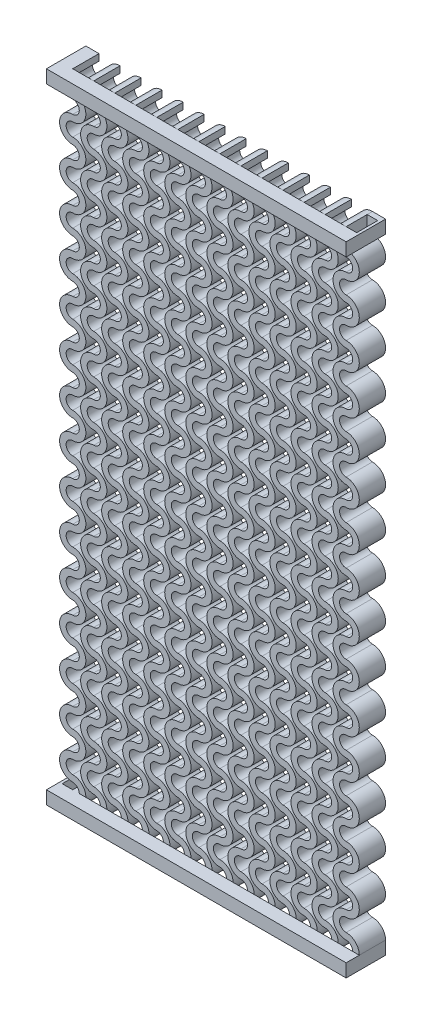
from build123d import *

# Parameters (mm, degrees)
BOSS_EXTRUDE1_DEPTH = 6.35
LPATTERN1_COUNT     = 14
LPATTERN1_PITCH     = 5.08
SKETCH5_W           = 3.175
SKETCH5_H           = 3.175
BOSS_EXTRUDE2_DEPTH = 69.215
SKETCH6_W           = 3.175
SKETCH6_H           = 3.175
BOSS_EXTRUDE3_DEPTH = 69.215
BOSS_EXTRUDE5_DEPTH = 6.35
BOSS_EXTRUDE6_DEPTH = 3.175
BOSS_EXTRUDE7_DEPTH = 3.175
CUT_EXTRUDE1_REACH  = 171.096
SKETCH11_W          = 2.54
SKETCH11_H          = 5.08
CUT_EXTRUDE2_REACH  = 171.096
SKETCH12_W          = 2.54
SKETCH12_H          = 5.08


with BuildPart() as part:
    # Sketch2 → Boss-Extrude1 (new body)
    with BuildSketch(Plane.XY):
        with BuildLine():
            Line((0, -3.175), (0, -1.5875))
            ThreePointArc((0, -1.5875), (1.5875, 0), (0, 1.5875))
            ThreePointArc((0, 1.5875), (-3.175, 4.7625), (0, 7.9375))
            ThreePointArc((0, 7.9375), (1.5875, 9.525), (0, 11.1125))
            ThreePointArc((0, 11.1125), (-3.175, 14.2875), (0, 17.4625))
            ThreePointArc((0, 17.4625), (1.5875, 19.05), (0, 20.6375))
            ThreePointArc((0, 20.6375), (-3.175, 23.8125), (0, 26.9875))
            ThreePointArc((0, 26.9875), (1.5875, 28.575), (0, 30.1625))
            ThreePointArc((0, 30.1625), (-3.175, 33.3375), (0, 36.5125))
            ThreePointArc((0, 36.5125), (1.5875, 38.1), (0, 39.6875))
            ThreePointArc((0, 39.6875), (-3.175, 42.8625), (0, 46.0375))
            ThreePointArc((0, 46.0375), (1.5875, 47.625), (0, 49.2125))
            ThreePointArc((0, 49.2125), (-3.175, 52.3875), (0, 55.5625))
            ThreePointArc((0, 55.5625), (1.5875, 57.15), (0, 58.7375))
            ThreePointArc((0, 58.7375), (-3.175, 61.9125), (0, 65.0875))
            ThreePointArc((0, 65.0875), (1.5875, 66.675), (0, 68.2625))
            ThreePointArc((0, 68.2625), (-3.175, 71.4375), (0, 74.6125))
            ThreePointArc((0, 74.6125), (1.5875, 76.2), (0, 77.7875))
            ThreePointArc((0, 77.7875), (-3.175, 80.9625), (0, 84.1375))
            ThreePointArc((0, 84.1375), (1.5875, 85.725), (0, 87.3125))
            ThreePointArc((0, 87.3125), (-3.175, 90.4875), (0, 93.6625))
            ThreePointArc((0, 93.6625), (1.5875, 95.25), (0, 96.8375))
            ThreePointArc((0, 96.8375), (-3.175, 100.0125), (0, 103.1875))
            ThreePointArc((0, 103.1875), (1.5875, 104.775), (0, 106.3625))
            ThreePointArc((0, 106.3625), (-3.175, 109.5375), (0, 112.7125))
            ThreePointArc((0, 112.7125), (1.5875, 114.3), (0, 115.8875))
            ThreePointArc((0, 115.8875), (-3.175, 119.0625), (0, 122.2375))
            ThreePointArc((0, 122.2375), (1.5875, 123.825), (0, 125.4125))
            ThreePointArc((0, 125.4125), (-3.175, 128.5875), (0, 131.7625))
            ThreePointArc((0, 131.7625), (1.5875, 133.35), (0, 134.9375))
            ThreePointArc((0, 134.9375), (-3.175, 138.1125), (0, 141.2875))
            ThreePointArc((0, 141.2875), (1.5875, 142.875), (0, 144.4625))
            ThreePointArc((0, 144.4625), (-3.175, 147.6375), (0, 150.8125))
            Line((0, 150.8125), (0, 149.225))
            ThreePointArc((0, 149.225), (-1.5875, 147.6375), (0, 146.05))
            ThreePointArc((0, 146.05), (3.175, 142.875), (0, 139.7))
            ThreePointArc((0, 139.7), (-1.5875, 138.1125), (0, 136.525))
            ThreePointArc((0, 136.525), (3.175, 133.35), (0, 130.175))
            ThreePointArc((0, 130.175), (-1.5875, 128.5875), (0, 127))
            ThreePointArc((0, 127), (3.175, 123.825), (0, 120.65))
            ThreePointArc((0, 120.65), (-1.5875, 119.0625), (0, 117.475))
            ThreePointArc((0, 117.475), (3.175, 114.3), (0, 111.125))
            ThreePointArc((0, 111.125), (-1.5875, 109.5375), (0, 107.95))
            ThreePointArc((0, 107.95), (3.175, 104.775), (0, 101.6))
            ThreePointArc((0, 101.6), (-1.5875, 100.0125), (0, 98.425))
            ThreePointArc((0, 98.425), (3.175, 95.25), (0, 92.075))
            ThreePointArc((0, 92.075), (-1.5875, 90.4875), (0, 88.9))
            ThreePointArc((0, 88.9), (3.175, 85.725), (0, 82.55))
            ThreePointArc((0, 82.55), (-1.5875, 80.9625), (0, 79.375))
            ThreePointArc((0, 79.375), (3.175, 76.2), (0, 73.025))
            ThreePointArc((0, 73.025), (-1.5875, 71.4375), (0, 69.85))
            ThreePointArc((0, 69.85), (3.175, 66.675), (0, 63.5))
            ThreePointArc((0, 63.5), (-1.5875, 61.9125), (0, 60.325))
            ThreePointArc((0, 60.325), (3.175, 57.15), (0, 53.975))
            ThreePointArc((0, 53.975), (-1.5875, 52.3875), (0, 50.8))
            ThreePointArc((0, 50.8), (3.175, 47.625), (0, 44.45))
            ThreePointArc((0, 44.45), (-1.5875, 42.8625), (0, 41.275))
            ThreePointArc((0, 41.275), (3.175, 38.1), (0, 34.925))
            ThreePointArc((0, 34.925), (-1.5875, 33.3375), (0, 31.75))
            ThreePointArc((0, 31.75), (3.175, 28.575), (0, 25.4))
            ThreePointArc((0, 25.4), (-1.5875, 23.8125), (0, 22.225))
            ThreePointArc((0, 22.225), (3.175, 19.05), (0, 15.875))
            ThreePointArc((0, 15.875), (-1.5875, 14.2875), (0, 12.7))
            ThreePointArc((0, 12.7), (3.175, 9.525), (0, 6.35))
            ThreePointArc((0, 6.35), (-1.5875, 4.7625), (0, 3.175))
            ThreePointArc((0, 3.175), (3.175, 0), (0, -3.175))
        make_face()
    extrude(amount=BOSS_EXTRUDE1_DEPTH)


with BuildPart() as lpattern1_1:
    # LPattern1: pattern copy
    add(part.part.moved(Location(Vector(1, 0, 0) * (1 * LPATTERN1_PITCH))))


with BuildPart() as lpattern1_2:
    # LPattern1: pattern copy
    add(part.part.moved(Location(Vector(1, 0, 0) * (2 * LPATTERN1_PITCH))))


with BuildPart() as lpattern1_3:
    # LPattern1: pattern copy
    add(part.part.moved(Location(Vector(1, 0, 0) * (3 * LPATTERN1_PITCH))))


with BuildPart() as lpattern1_4:
    # LPattern1: pattern copy
    add(part.part.moved(Location(Vector(1, 0, 0) * (4 * LPATTERN1_PITCH))))


with BuildPart() as lpattern1_5:
    # LPattern1: pattern copy
    add(part.part.moved(Location(Vector(1, 0, 0) * (5 * LPATTERN1_PITCH))))


with BuildPart() as lpattern1_6:
    # LPattern1: pattern copy
    add(part.part.moved(Location(Vector(1, 0, 0) * (6 * LPATTERN1_PITCH))))


with BuildPart() as lpattern1_7:
    # LPattern1: pattern copy
    add(part.part.moved(Location(Vector(1, 0, 0) * (7 * LPATTERN1_PITCH))))


with BuildPart() as lpattern1_8:
    # LPattern1: pattern copy
    add(part.part.moved(Location(Vector(1, 0, 0) * (8 * LPATTERN1_PITCH))))


with BuildPart() as lpattern1_9:
    # LPattern1: pattern copy
    add(part.part.moved(Location(Vector(1, 0, 0) * (9 * LPATTERN1_PITCH))))


with BuildPart() as lpattern1_10:
    # LPattern1: pattern copy
    add(part.part.moved(Location(Vector(1, 0, 0) * (10 * LPATTERN1_PITCH))))


with BuildPart() as lpattern1_11:
    # LPattern1: pattern copy
    add(part.part.moved(Location(Vector(1, 0, 0) * (11 * LPATTERN1_PITCH))))


with BuildPart() as lpattern1_12:
    # LPattern1: pattern copy
    add(part.part.moved(Location(Vector(1, 0, 0) * (12 * LPATTERN1_PITCH))))


with BuildPart() as lpattern1_13:
    # LPattern1: pattern copy
    add(part.part.moved(Location(Vector(1, 0, 0) * (13 * LPATTERN1_PITCH))))


with BuildPart() as part_1:
    add(part.part)

    add(lpattern1_1.part)  # Boss-Extrude2 merges LPattern1_1

    add(lpattern1_2.part)  # Boss-Extrude2 merges LPattern1_2

    add(lpattern1_3.part)  # Boss-Extrude2 merges LPattern1_3

    add(lpattern1_4.part)  # Boss-Extrude2 merges LPattern1_4

    add(lpattern1_5.part)  # Boss-Extrude2 merges LPattern1_5

    add(lpattern1_6.part)  # Boss-Extrude2 merges LPattern1_6

    add(lpattern1_7.part)  # Boss-Extrude2 merges LPattern1_7

    add(lpattern1_8.part)  # Boss-Extrude2 merges LPattern1_8

    add(lpattern1_9.part)  # Boss-Extrude2 merges LPattern1_9

    add(lpattern1_10.part)  # Boss-Extrude2 merges LPattern1_10

    add(lpattern1_11.part)  # Boss-Extrude2 merges LPattern1_11

    add(lpattern1_12.part)  # Boss-Extrude2 merges LPattern1_12

    add(lpattern1_13.part)  # Boss-Extrude2 merges LPattern1_13
    # Sketch5 → Boss-Extrude2 (add, through all)
    with BuildSketch(Plane(origin=(66.04, 0, 0), x_dir=(0, 0, -1), z_dir=(1, 0, 0))):
        with Locations((-7.9375, 149.225)):
            Rectangle(SKETCH5_W, SKETCH5_H)
    extrude(amount=-BOSS_EXTRUDE2_DEPTH)

    # Sketch6 → Boss-Extrude3 (add, through all)
    with BuildSketch(Plane.ZY):
        with Locations((7.9375, -1.5875)):
            Rectangle(SKETCH6_W, SKETCH6_H)
    extrude(amount=-BOSS_EXTRUDE3_DEPTH)

    # Sketch8 → Boss-Extrude5 (add, through all)
    with BuildSketch(Plane(origin=(0, 0, 6.35), x_dir=(-1, 0, 0), z_dir=(0, 0, -1))):
        with BuildLine():
            Line((-66.04, 147.6375), (-64.4525, 147.6375))
            ThreePointArc((-64.4525, 147.6375), (-64.917467985, 148.760032015), (-66.04, 149.225))
            Line((-66.04, 149.225), (-66.04, 147.6375))
        make_face()
        with BuildLine():
            Line((3.175, 147.6375), (3.175, 150.8125))
            Line((3.175, 150.8125), (0, 150.8125))
            ThreePointArc((0, 150.8125), (2.24506403, 149.88256403), (3.175, 147.6375))
        make_face()
        with BuildLine():
            Line((0, -1.5875), (0, 0))
            Line((0, 0), (-1.5875, 0))
            ThreePointArc((-1.5875, 0), (-1.122532015, -1.122532015), (0, -1.5875))
        make_face()
        with BuildLine():
            Line((-69.215, 0), (-69.215, -3.175))
            Line((-69.215, -3.175), (-66.04, -3.175))
            ThreePointArc((-66.04, -3.175), (-68.28506403, -2.24506403), (-69.215, 0))
        make_face()
    extrude(amount=BOSS_EXTRUDE5_DEPTH)

    # Sketch9 → Boss-Extrude6 (add, through all)
    with BuildSketch(Plane.ZY):
        Polygon((9.525, 0), (0, 0), (0, -3.175), (6.35, -3.175), (9.525, -3.175), align=None)
    extrude(amount=BOSS_EXTRUDE6_DEPTH)

    # Sketch10 → Boss-Extrude7 (add, through all)
    with BuildSketch(Plane(origin=(66.04, 0, 0), x_dir=(0, 0, -1), z_dir=(1, 0, 0))):
        Polygon((-9.525, 147.6375), (0, 147.6375), (0, 150.8125), (-6.35, 150.8125), (-9.525, 150.8125), align=None)
    extrude(amount=BOSS_EXTRUDE7_DEPTH)

    # Sketch11 → Cut-Extrude1 (cut, up to next)
    with BuildSketch(Plane(origin=(0, 150.8125, 0), x_dir=(1, 0, 0), z_dir=(0, 1, 0)), mode=Mode.PRIVATE) as cut_extrude1_sk1:
        with Locations((67.31, -3.81)):
            Rectangle(SKETCH11_W, SKETCH11_H)
    cut_extrude1_tool1 = extrude(cut_extrude1_sk1.sketch, amount=-CUT_EXTRUDE1_REACH, mode=Mode.PRIVATE) & part_1.part
    add(cut_extrude1_tool1.solids().sort_by_distance((67.31, 150.8125, 3.81))[0], mode=Mode.SUBTRACT)

    # Sketch12 → Cut-Extrude2 (cut, up to next)
    with BuildSketch(Plane.XZ.offset(3.175), mode=Mode.PRIVATE) as cut_extrude2_sk1:
        with Locations((-1.27, 3.81)):
            Rectangle(SKETCH12_W, SKETCH12_H)
    cut_extrude2_tool1 = extrude(cut_extrude2_sk1.sketch, amount=-CUT_EXTRUDE2_REACH, mode=Mode.PRIVATE) & part_1.part
    add(cut_extrude2_tool1.solids().sort_by_distance((-1.27, -3.175, 3.81))[0], mode=Mode.SUBTRACT)


solid = part_1.part
